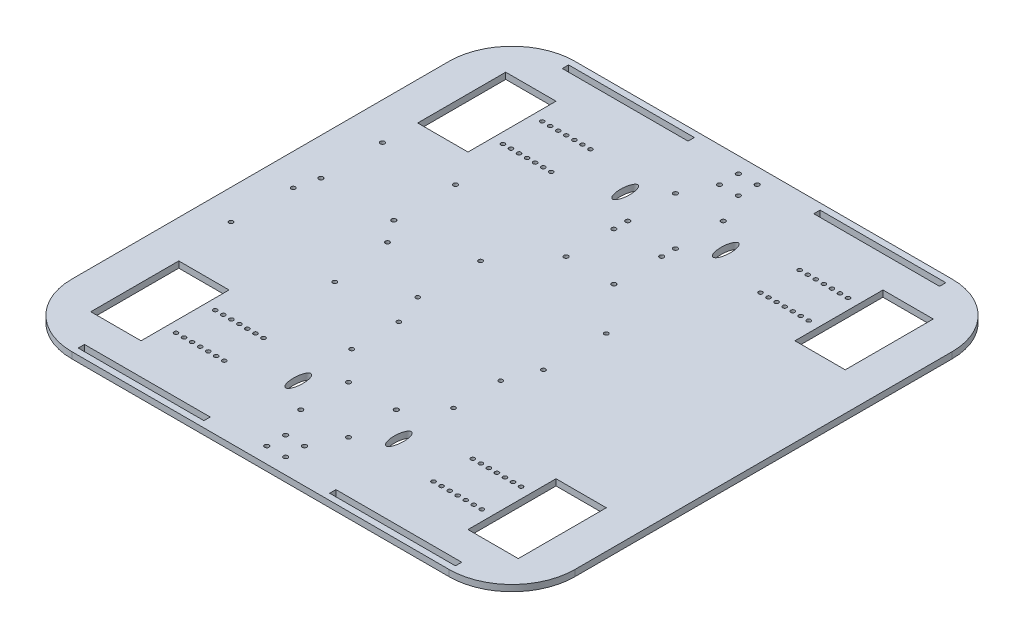
from build123d import *

# Parameters (mm, degrees)
SKETCH1_W           = 400
SKETCH1_H           = 400
SKETCH1_R           = 1.75
SKETCH1_W_2         = 40
SKETCH1_H_2         = 70
BOSS_EXTRUDE2_DEPTH = 5
FILLET1_R           = 50
SKETCH2_R           = 1.6
CUT_EXTRUDE1_DEPTH  = 5
SKETCH3_R           = 1.65
CUT_EXTRUDE2_DEPTH  = 10
SKETCH4_R           = 1.75
CUT_EXTRUDE3_DEPTH  = 10
SKETCH5_R           = 1.75
CUT_EXTRUDE4_DEPTH  = 10
SKETCH6_RX          = 10
SKETCH6_RY          = 3.75
CUT_EXTRUDE5_DEPTH  = 10
SKETCH7_R           = 1.65
CUT_EXTRUDE6_DEPTH  = 10
SKETCH8_R           = 1.65
CUT_EXTRUDE7_DEPTH  = 5
SKETCH9_W           = 100
SKETCH9_H           = 5
CUT_EXTRUDE8_DEPTH  = 10


with BuildPart() as part:
    # Sketch1 → Boss-Extrude2 (new body)
    with BuildSketch(Plane(origin=(0, 0, 0), x_dir=(1, 0, 0), z_dir=(0, 1, 0))):
        Rectangle(SKETCH1_W, SKETCH1_H)
        with Locations((-7.5, 172.5)):
            Circle(SKETCH1_R, mode=Mode.SUBTRACT)
        with Locations((-7.5, 187.5)):
            Circle(SKETCH1_R, mode=Mode.SUBTRACT)
        with Locations((7.5, 172.5)):
            Circle(SKETCH1_R, mode=Mode.SUBTRACT)
        with Locations((7.5, 187.5)):
            Circle(SKETCH1_R, mode=Mode.SUBTRACT)
        with Locations((-150, -130)):
            Rectangle(SKETCH1_W_2, SKETCH1_H_2, mode=Mode.SUBTRACT)
        with Locations((150, -130)):
            Rectangle(SKETCH1_W_2, SKETCH1_H_2, mode=Mode.SUBTRACT)
        with Locations((-150, 130)):
            Rectangle(SKETCH1_W_2, SKETCH1_H_2, mode=Mode.SUBTRACT)
        with Locations((150, 130)):
            Rectangle(SKETCH1_W_2, SKETCH1_H_2, mode=Mode.SUBTRACT)
        with Locations((-7.5, -187.5)):
            Circle(SKETCH1_R, mode=Mode.SUBTRACT)
        with Locations((-7.5, -172.5)):
            Circle(SKETCH1_R, mode=Mode.SUBTRACT)
        with Locations((7.5, -187.5)):
            Circle(SKETCH1_R, mode=Mode.SUBTRACT)
        with Locations((7.5, -172.5)):
            Circle(SKETCH1_R, mode=Mode.SUBTRACT)
    extrude(amount=BOSS_EXTRUDE2_DEPTH)

    # Fillet1
    fillet1_edges = [part.edges().sort_by_distance(p)[0] for p in [
        (200, 2.5, -200),
        (200, 2.5, 200),
        (-200, 2.5, 200),
        (-200, 2.5, -200),
    ]]
    fillet(fillet1_edges, radius=FILLET1_R)

    # Sketch2 → Cut-Extrude1 (cut)
    with BuildSketch(Plane(origin=(0, 5, 0), x_dir=(1, 0, 0), z_dir=(0, 1, 0))):
        with Locations((-121.6, 145.6)):
            Circle(SKETCH2_R)
        with Locations((-115.2, 145.6)):
            Circle(SKETCH2_R)
        with Locations((-108.8, 145.6)):
            Circle(SKETCH2_R)
        with Locations((-102.4, 145.6)):
            Circle(SKETCH2_R)
        with Locations((-96, 145.6)):
            Circle(SKETCH2_R)
        with Locations((-89.6, 145.6)):
            Circle(SKETCH2_R)
        with Locations((-83.2, 145.6)):
            Circle(SKETCH2_R)
        with Locations((-83.2, 114.4)):
            Circle(SKETCH2_R)
        with Locations((-89.6, 114.4)):
            Circle(SKETCH2_R)
        with Locations((-96, 114.4)):
            Circle(SKETCH2_R)
        with Locations((-102.4, 114.4)):
            Circle(SKETCH2_R)
        with Locations((-108.8, 114.4)):
            Circle(SKETCH2_R)
        with Locations((-115.2, 114.4)):
            Circle(SKETCH2_R)
        with Locations((-121.6, 114.4)):
            Circle(SKETCH2_R)
        with Locations((83.2, 114.4)):
            Circle(SKETCH2_R)
        with Locations((89.6, 114.4)):
            Circle(SKETCH2_R)
        with Locations((96, 114.4)):
            Circle(SKETCH2_R)
        with Locations((102.4, 114.4)):
            Circle(SKETCH2_R)
        with Locations((108.8, 114.4)):
            Circle(SKETCH2_R)
        with Locations((115.2, 114.4)):
            Circle(SKETCH2_R)
        with Locations((121.6, 114.4)):
            Circle(SKETCH2_R)
        with Locations((83.2, 145.6)):
            Circle(SKETCH2_R)
        with Locations((89.6, 145.6)):
            Circle(SKETCH2_R)
        with Locations((96, 145.6)):
            Circle(SKETCH2_R)
        with Locations((102.4, 145.6)):
            Circle(SKETCH2_R)
        with Locations((108.8, 145.6)):
            Circle(SKETCH2_R)
        with Locations((115.2, 145.6)):
            Circle(SKETCH2_R)
        with Locations((121.6, 145.6)):
            Circle(SKETCH2_R)
        with Locations((121.6, -145.6)):
            Circle(SKETCH2_R)
        with Locations((115.2, -145.6)):
            Circle(SKETCH2_R)
        with Locations((108.8, -145.6)):
            Circle(SKETCH2_R)
        with Locations((102.4, -145.6)):
            Circle(SKETCH2_R)
        with Locations((96, -145.6)):
            Circle(SKETCH2_R)
        with Locations((89.6, -145.6)):
            Circle(SKETCH2_R)
        with Locations((83.2, -145.6)):
            Circle(SKETCH2_R)
        with Locations((121.6, -114.4)):
            Circle(SKETCH2_R)
        with Locations((115.2, -114.4)):
            Circle(SKETCH2_R)
        with Locations((108.8, -114.4)):
            Circle(SKETCH2_R)
        with Locations((102.4, -114.4)):
            Circle(SKETCH2_R)
        with Locations((96, -114.4)):
            Circle(SKETCH2_R)
        with Locations((89.6, -114.4)):
            Circle(SKETCH2_R)
        with Locations((83.2, -114.4)):
            Circle(SKETCH2_R)
        with Locations((-121.6, -114.4)):
            Circle(SKETCH2_R)
        with Locations((-115.2, -114.4)):
            Circle(SKETCH2_R)
        with Locations((-108.8, -114.4)):
            Circle(SKETCH2_R)
        with Locations((-102.4, -114.4)):
            Circle(SKETCH2_R)
        with Locations((-96, -114.4)):
            Circle(SKETCH2_R)
        with Locations((-89.6, -114.4)):
            Circle(SKETCH2_R)
        with Locations((-83.2, -114.4)):
            Circle(SKETCH2_R)
        with Locations((-83.2, -145.6)):
            Circle(SKETCH2_R)
        with Locations((-89.6, -145.6)):
            Circle(SKETCH2_R)
        with Locations((-96, -145.6)):
            Circle(SKETCH2_R)
        with Locations((-102.4, -145.6)):
            Circle(SKETCH2_R)
        with Locations((-108.8, -145.6)):
            Circle(SKETCH2_R)
        with Locations((-115.2, -145.6)):
            Circle(SKETCH2_R)
        with Locations((-121.6, -145.6)):
            Circle(SKETCH2_R)
    extrude(amount=-CUT_EXTRUDE1_DEPTH, mode=Mode.SUBTRACT)

    # Sketch3 → Cut-Extrude2 (cut)
    with BuildSketch(Plane(origin=(0, 5, 0), x_dir=(1, 0, 0), z_dir=(0, 1, 0))):
        with Locations((-176.03, -47.46)):
            Circle(SKETCH3_R)
        with Locations((-174.76, 0.8)):
            Circle(SKETCH3_R)
        with Locations((-93.48, -47.46)):
            Circle(SKETCH3_R)
        with Locations((-99.83, 0.8)):
            Circle(SKETCH3_R)
    extrude(amount=-CUT_EXTRUDE2_DEPTH, mode=Mode.SUBTRACT)

    # Sketch4 → Cut-Extrude3 (cut)
    with BuildSketch(Plane(origin=(0, 5, 0), x_dir=(1, 0, 0), z_dir=(0, 1, 0))):
        with Locations((-19, 149)):
            Circle(SKETCH4_R)
        with Locations((19, 149)):
            Circle(SKETCH4_R)
        with Locations((19, 111)):
            Circle(SKETCH4_R)
        with Locations((-19, 111)):
            Circle(SKETCH4_R)
        with Locations((-19, 100)):
            Circle(SKETCH4_R)
        with Locations((19, 100)):
            Circle(SKETCH4_R)
        with Locations((19, 62)):
            Circle(SKETCH4_R)
        with Locations((-19, 62)):
            Circle(SKETCH4_R)
        with Locations((-19, -149)):
            Circle(SKETCH4_R)
        with Locations((19, -149)):
            Circle(SKETCH4_R)
        with Locations((-19, -111)):
            Circle(SKETCH4_R)
        with Locations((19, -111)):
            Circle(SKETCH4_R)
    extrude(amount=-CUT_EXTRUDE3_DEPTH, mode=Mode.SUBTRACT)

    # Sketch5 → Cut-Extrude4 (cut)
    with BuildSketch(Plane(origin=(0, 5, 0), x_dir=(1, 0, 0), z_dir=(0, 1, 0))):
        with Locations((-170.5, 67.5)):
            Circle(SKETCH5_R)
        with Locations((-112.5, 67.5)):
            Circle(SKETCH5_R)
        with Locations((-112.5, 18.5)):
            Circle(SKETCH5_R)
        with Locations((-170.5, 18.5)):
            Circle(SKETCH5_R)
    extrude(amount=-CUT_EXTRUDE4_DEPTH, mode=Mode.SUBTRACT)

    # Sketch6 → Cut-Extrude5 (cut)
    with BuildSketch(Plane(origin=(0, 5, 0), x_dir=(1, 0, 0), z_dir=(0, 1, 0))):
        with Locations(Location((-40, 130), (0, 0, 90))):
            Ellipse(SKETCH6_RX, SKETCH6_RY)
        with Locations(Location((40, 130), (0, 0, 90))):
            Ellipse(SKETCH6_RX, SKETCH6_RY)
        with Locations(Location((40, -130), (0, 0, -90))):
            Ellipse(SKETCH6_RX, SKETCH6_RY)
        with Locations(Location((-40, -130), (0, 0, -90))):
            Ellipse(SKETCH6_RX, SKETCH6_RY)
    extrude(amount=-CUT_EXTRUDE5_DEPTH, mode=Mode.SUBTRACT)

    # Sketch7 → Cut-Extrude6 (cut)
    with BuildSketch(Plane(origin=(0, 5, 0), x_dir=(1, 0, 0), z_dir=(0, 1, 0))):
        with Locations((-50, 25)):
            Circle(SKETCH7_R)
        with Locations((50, 25)):
            Circle(SKETCH7_R)
        with Locations((50, -25)):
            Circle(SKETCH7_R)
        with Locations((-50, -25)):
            Circle(SKETCH7_R)
    extrude(amount=-CUT_EXTRUDE6_DEPTH, mode=Mode.SUBTRACT)

    # Sketch8 → Cut-Extrude7 (cut)
    with BuildSketch(Plane(origin=(0, 5, 0), x_dir=(1, 0, 0), z_dir=(0, 1, 0))):
        with Locations((-40.5, -49.5)):
            Circle(SKETCH8_R)
        with Locations((40.5, -49.5)):
            Circle(SKETCH8_R)
        with Locations((40.5, -87)):
            Circle(SKETCH8_R)
        with Locations((-40.5, -87)):
            Circle(SKETCH8_R)
    extrude(amount=-CUT_EXTRUDE7_DEPTH, mode=Mode.SUBTRACT)

    # Sketch9 → Cut-Extrude8 (cut)
    with BuildSketch(Plane(origin=(0, 5, 0), x_dir=(1, 0, 0), z_dir=(0, 1, 0))):
        with Locations((-100, 192.5)):
            Rectangle(SKETCH9_W, SKETCH9_H)
        with Locations((100, 192.5)):
            Rectangle(SKETCH9_W, SKETCH9_H)
        with Locations((100, -192.5)):
            Rectangle(SKETCH9_W, SKETCH9_H)
        with Locations((-100, -192.5)):
            Rectangle(SKETCH9_W, SKETCH9_H)
    extrude(amount=-CUT_EXTRUDE8_DEPTH, mode=Mode.SUBTRACT)


solid = part.part
